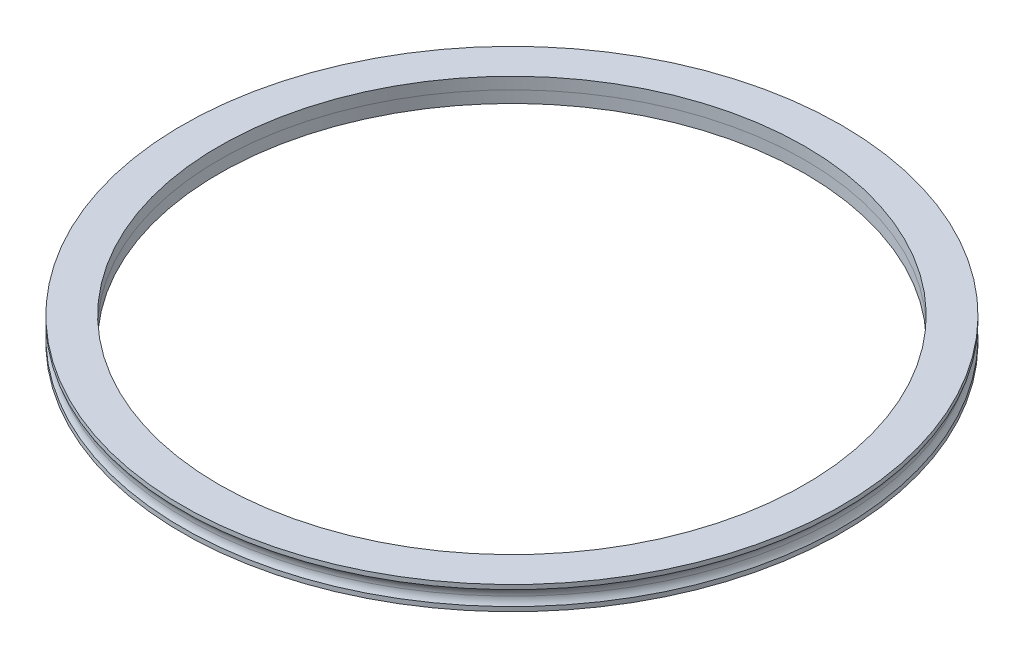
from build123d import *


with BuildPart() as part:
    # Sketch1 → Revolve1 (revolve)
    with BuildSketch(Plane.XY):
        with BuildLine():
            Line((-67.5, 17.585), (-67.5, 18.5))
            Line((-67.5, 18.5), (-60, 18.5))
            Line((-60, 18.5), (-60, 13.67))
            Line((-60, 13.67), (-67.5, 13.67))
            Line((-67.5, 13.67), (-67.5, 14.585))
            ThreePointArc((-67.5, 14.585), (-67, 16.085), (-67.5, 17.585))
        make_face()
    revolve(axis=Axis((0, -200069.047495165, 0), (0, 1, 0)))


with BuildPart() as body_2:
    # Split1: the piece on the far side of the plane
    add(part.part)
    split(bisect_by=Plane.ZX.offset(16.085), keep=Keep.BOTTOM)


with BuildPart() as part_1:
    add(part.part)

    # Split1
    split(bisect_by=Plane.ZX.offset(16.085), keep=Keep.TOP)


solid = Compound([body_2.part, part_1.part])
